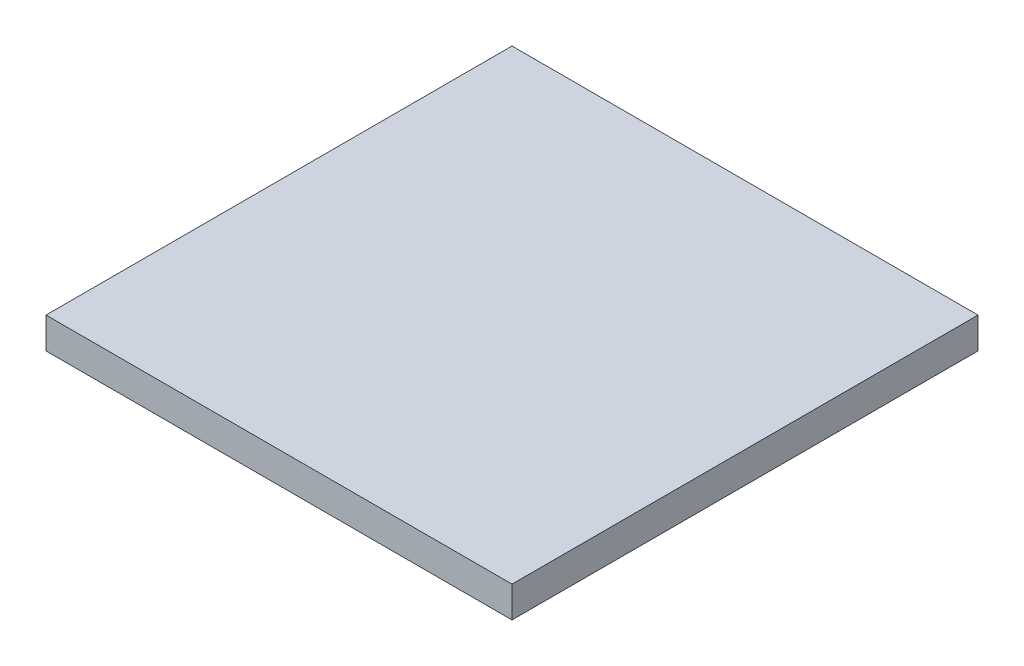
from build123d import *

# Parameters (mm, degrees)
SKETCH1_W           = 38.1
SKETCH1_H           = 38.1
BOSS_EXTRUDE1_DEPTH = 2.54


with BuildPart() as part:
    # Sketch1 → Boss-Extrude1 (new body)
    with BuildSketch(Plane(origin=(0, 0, 0), x_dir=(1, 0, 0), z_dir=(0, 1, 0))):
        Rectangle(SKETCH1_W, SKETCH1_H)
    extrude(amount=BOSS_EXTRUDE1_DEPTH)


solid = part.part
